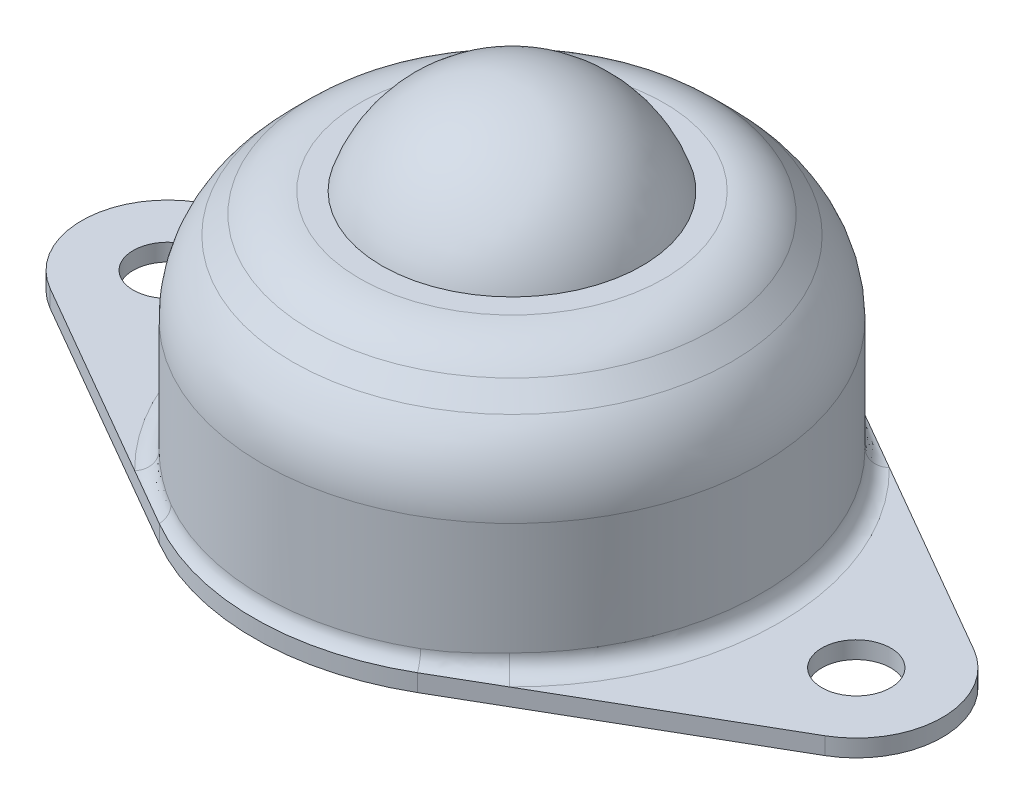
from build123d import *

# Parameters (mm, degrees)
SKETCH_1_R      = 2
EXTRUDE_1_DEPTH = 1
SKETCH_2_R      = 14.5
EXTRUDE_2_DEPTH = 14
CHAMFER_1_SIZE  = 4
FILLET_2_R      = 6
FILLET_3_R      = 4
FILLET_4_R      = 1


with BuildPart() as part:
    # 草图1 → 凸台-拉伸1 (new body)
    with BuildSketch(Plane(origin=(0, 0, 0), x_dir=(1, 0, 0), z_dir=(0, 1, 0))):
        with BuildLine():
            Line((-7.5, 12.990381057), (-22.5, 4.330127019))
            ThreePointArc((-22.5, 4.330127019), (-25, 0), (-22.5, -4.330127019))
            Line((-22.5, -4.330127019), (-7.5, -12.990381057))
            ThreePointArc((-7.5, -12.990381057), (0, -15), (7.5, -12.990381057))
            Line((7.5, -12.990381057), (22.5, -4.330127019))
            ThreePointArc((22.5, -4.330127019), (25, 0), (22.5, 4.330127019))
            Line((22.5, 4.330127019), (7.5, 12.990381057))
            ThreePointArc((7.5, 12.990381057), (0, 15), (-7.5, 12.990381057))
        make_face()
        with Locations((-20, 0)):
            Circle(SKETCH_1_R, mode=Mode.SUBTRACT)
        with Locations((20, 0)):
            Circle(SKETCH_1_R, mode=Mode.SUBTRACT)
    extrude(amount=EXTRUDE_1_DEPTH)

    # 草图2 → 凸台-拉伸2 (add)
    with BuildSketch(Plane(origin=(0, 1, 0), x_dir=(1, 0, 0), z_dir=(0, 1, 0))):
        Circle(SKETCH_2_R)
    extrude(amount=EXTRUDE_2_DEPTH)

    # 草图3 → 旋转3 (revolve)
    with BuildSketch(Plane.XY):
        with BuildLine():
            Line((0, 4.62), (0, 20.5))
            ThreePointArc((0, 20.5), (-7.94, 12.56), (0, 4.62))
        make_face()
    revolve(axis=Axis((0, 4.62, 0), (0, 1, 0)))

    # Chamfer 1
    chamfer_1_edges = [part.edges().sort_by_distance(p)[0] for p in [
        (-14.5, 15, 0),
    ]]
    chamfer(chamfer_1_edges, length=CHAMFER_1_SIZE)

    # 圆角2
    fillet_2_edges = [part.edges().sort_by_distance(p)[0] for p in [
        (-14.5, 11, 0),
    ]]
    fillet(fillet_2_edges, radius=FILLET_2_R)

    # 圆角3
    fillet_3_edges = [part.edges().sort_by_distance(p)[0] for p in [
        (-10.5, 15, 0),
    ]]
    fillet(fillet_3_edges, radius=FILLET_3_R)

    # 圆角4
    fillet_4_edges = [part.edges().sort_by_distance(p)[0] for p in [
        (-14.5, 1, 0),
    ]]
    fillet(fillet_4_edges, radius=FILLET_4_R)


solid = part.part
